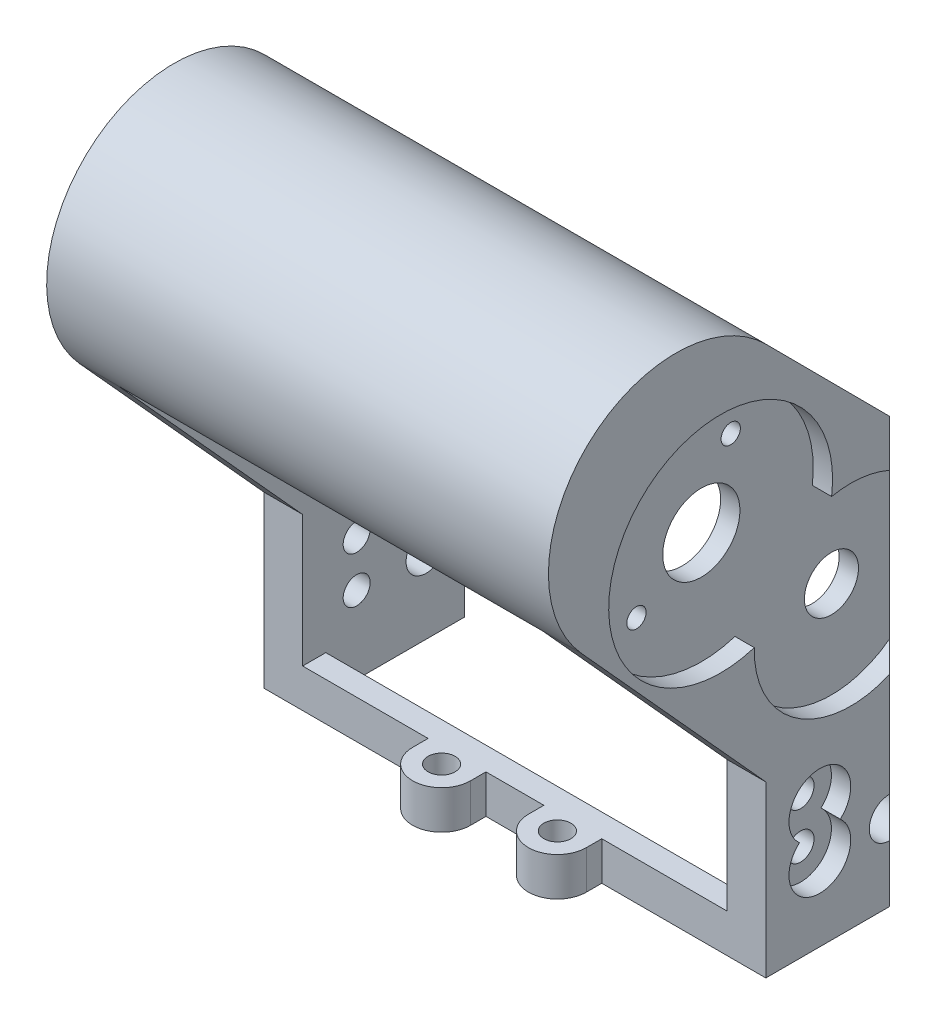
from build123d import *

# Parameters (mm, degrees)
BOSS_EXTRUDE1_DEPTH     = 32.5
SHELL4_START            = -27.5
SHELL4_DEPTH            = 55
CUT_EXTRUDE2_DEPTH      = 21
CUT_EXTRUDE2_DEPTH_BACK = 20
SKETCH4_W               = 55
SKETCH4_H               = 18
CHAMFER18_START         = -24
CHAMFER18_OUTLINE_W     = 10
CHAMFER18_OUTLINE_H     = 57
CHAMFER18_DEPTH         = 4.554563517
CHAMFER36_START         = 19.445436483
CHAMFER36_OUTLINE_W     = 10
CHAMFER36_OUTLINE_H     = 57
CHAMFER36_DEPTH         = 4.554563517
SKETCH8_R               = 2.6
SKETCH8_R_2             = 1.75
SKETCH8_R_3             = 5
SKETCH8_R_4             = 3.5
SKETCH8_R_5             = 1.25
CUT_EXTRUDE4_DEPTH      = 185
CUT_EXTRUDE6_DEPTH      = 4.5
CUT_EXTRUDE8_DEPTH      = 17
CUT_EXTRUDE8_DEPTH_BACK = 5.1
SKETCH13_R              = 1.5
SKETCH14_R              = 1.75
BOSS_EXTRUDE2_DEPTH     = 5


with BuildPart() as part:
    # Sketch3 → Boss-Extrude1 (new, symmetric)
    with BuildSketch(Plane(origin=(0, 0, 0), x_dir=(0, 0, -1), z_dir=(1, 0, 0))):
        with BuildLine():
            Line((0, 50), (-20.96, 71.073578053))
            ThreePointArc((-20.96, 71.073578053), (-44.01947273, 71.403830624), (-44.885431169, 48.358256964))
            Line((-44.885431169, 48.358256964), (-21, 22))
            Line((-21, 22), (-21, 0))
            Line((-21, 0), (0, 0))
            Line((0, 0), (0, 50))
        make_face()
    extrude(amount=BOSS_EXTRUDE1_DEPTH, both=True)

    # Shell4: read off the stored shape, not the designer's step
    # Shell4 outline → Shell4 (cut)
    with BuildSketch(Plane.YZ.offset(SHELL4_START)):
        with BuildLine():
            Line((51.715719855, 41.180374768), (48.358256964, 44.885431169))
            Line((48.358256964, 44.885431169), (22, 21))
            Line((22, 21), (5, 21))
            Line((5, 21), (5, 0))
            Line((5, 0), (50, 0))
            Line((50, 0), (71.073578053, 20.96))
            Line((71.073578053, 20.96), (67.547610311, 24.505074257))
            ThreePointArc((67.547610311, 24.505074257), (67.777786345, 40.576827978), (51.715719855, 41.180374768))
        make_face()
    extrude(amount=SHELL4_DEPTH, mode=Mode.SUBTRACT)

    # Sketch4 → Cut-Extrude2 (cut, two sides: drawn at the far end of the back side and taken through both)
    with BuildSketch(Plane.XZ.offset(-CUT_EXTRUDE2_DEPTH_BACK)):
        with Locations((0, 9)):
            Rectangle(SKETCH4_W, SKETCH4_H)
    extrude(amount=CUT_EXTRUDE2_DEPTH + CUT_EXTRUDE2_DEPTH_BACK, mode=Mode.SUBTRACT)

    # Chamfer18: read off the stored shape, not the designer's step
    # Chamfer18 outline → Chamfer18 (cut)
    with BuildSketch(Plane(origin=(0, 0, 0), x_dir=(0.707106781186548, 0, -0.707106781186547), z_dir=(0.707106781186547, 0, 0.707106781186548)).offset(CHAMFER18_START)):
        with Locations((-23, 28.5)):
            Rectangle(CHAMFER18_OUTLINE_W, CHAMFER18_OUTLINE_H)
    extrude(amount=CHAMFER18_DEPTH, mode=Mode.SUBTRACT)

    # Chamfer36: read off the stored shape, not the designer's step
    # Chamfer36 outline → Chamfer36 (cut)
    with BuildSketch(Plane(origin=(0, 0, 0), x_dir=(0.707106781186548, 0, 0.707106781186547), z_dir=(0.707106781186547, 0, -0.707106781186548)).offset(CHAMFER36_START)):
        with Locations((23, -28.5)):
            Rectangle(CHAMFER36_OUTLINE_W, CHAMFER36_OUTLINE_H)
    extrude(amount=CHAMFER36_DEPTH, mode=Mode.SUBTRACT)

    # Sketch8 → Cut-Extrude4 (cut)
    with BuildSketch(Plane.ZY.offset(33.5)):
        with Locations(Location((5, 10, 0), (0, 0, 270))):
            Circle(SKETCH8_R)
        with Locations(Location((14, 10, 0), (0, 0, 180))):
            Circle(SKETCH8_R_2)
        with Locations(Location((14, 16, 0), (0, 0, 180))):
            Circle(SKETCH8_R_2)
        with Locations(Location((26.852977749, 51.641327413, 0), (0, 0, 180))):
            Circle(SKETCH8_R_3)
        with Locations(Location((10, 37.5, 0), (0, 0, 180))):
            Circle(SKETCH8_R_4)
        with Locations(Location((35.25759337, 46.292268033, 0), (0, 0, 180))):
            Circle(SKETCH8_R_5)
        with Locations(Location((23.044628786, 60.847112452, 0), (0, 0, 180))):
            Circle(SKETCH8_R_5)
    extrude(amount=-CUT_EXTRUDE4_DEPTH, mode=Mode.SUBTRACT)

    # Sketch10 → Cut-Extrude6 (cut)
    with BuildSketch(Plane.ZY.offset(34.5)):
        with BuildLine():
            ThreePointArc((16.645751311, 13), (14, 20), (11.354248689, 13))
            ThreePointArc((11.354248689, 13), (14, 6), (16.645751311, 13))
        make_face()
        with BuildLine():
            ThreePointArc((12.476565423, 49.752208932), (0.424444461, 29.465154879), (22.49612142, 37.811367076))
            ThreePointArc((22.49612142, 37.811367076), (37.960622174, 60.961747754), (12.476565423, 49.752208932))
        make_face()
    cut_extrude6 = extrude(amount=-CUT_EXTRUDE6_DEPTH, mode=Mode.SUBTRACT)

    # Mirror1: Cut-Extrude6 across plane
    add(cut_extrude6.mirror(Plane(origin=(0, 0, 0), x_dir=(0, 0, 1), z_dir=(1, 0, 0))), mode=Mode.SUBTRACT)

    # Sketch13 → Cut-Extrude8 (cut, two sides: drawn at the far end of the back side and taken through both)
    with BuildSketch(Plane.XZ.offset(-CUT_EXTRUDE8_DEPTH_BACK)):
        with Locations(Location((-30, 11.354248689, 0), (0, 0, 90))):
            Circle(SKETCH13_R)
        with Locations(Location((30, 11.354248689, 0), (0, 0, 90))):
            Circle(SKETCH13_R)
    extrude(amount=CUT_EXTRUDE8_DEPTH + CUT_EXTRUDE8_DEPTH_BACK, mode=Mode.SUBTRACT)

    # Sketch14 → Boss-Extrude2 (add)
    # profile 1 of 2: a face of its own
    with BuildSketch(Plane.XZ):
        with BuildLine():
            Line((-3.749981176, 23), (-3.749981176, 21))
            Line((-3.749981176, 21), (-11.249981176, 21))
            Line((-11.249981176, 21), (-11.249981176, 23))
            ThreePointArc((-11.249981176, 23), (-7.499981176, 26.75), (-3.749981176, 23))
        make_face()
        with Locations(Location((-7.499981176, 23, 0), (0, 0, 270))):
            Circle(SKETCH14_R, mode=Mode.SUBTRACT)
    # profile 2 of 2: a face of its own
    with BuildSketch(Plane.XZ):
        with BuildLine():
            Line((3.750018824, 23), (3.750018824, 20.96))
            Line((3.750018824, 20.96), (11.250018824, 20.96))
            Line((11.250018824, 20.96), (11.250018824, 23))
            ThreePointArc((11.250018824, 23), (7.500018824, 26.75), (3.750018824, 23))
        make_face()
        with Locations(Location((7.500018824, 23, 0), (0, 0, 270))):
            Circle(SKETCH14_R, mode=Mode.SUBTRACT)
    extrude(amount=-BOSS_EXTRUDE2_DEPTH)


solid = part.part
